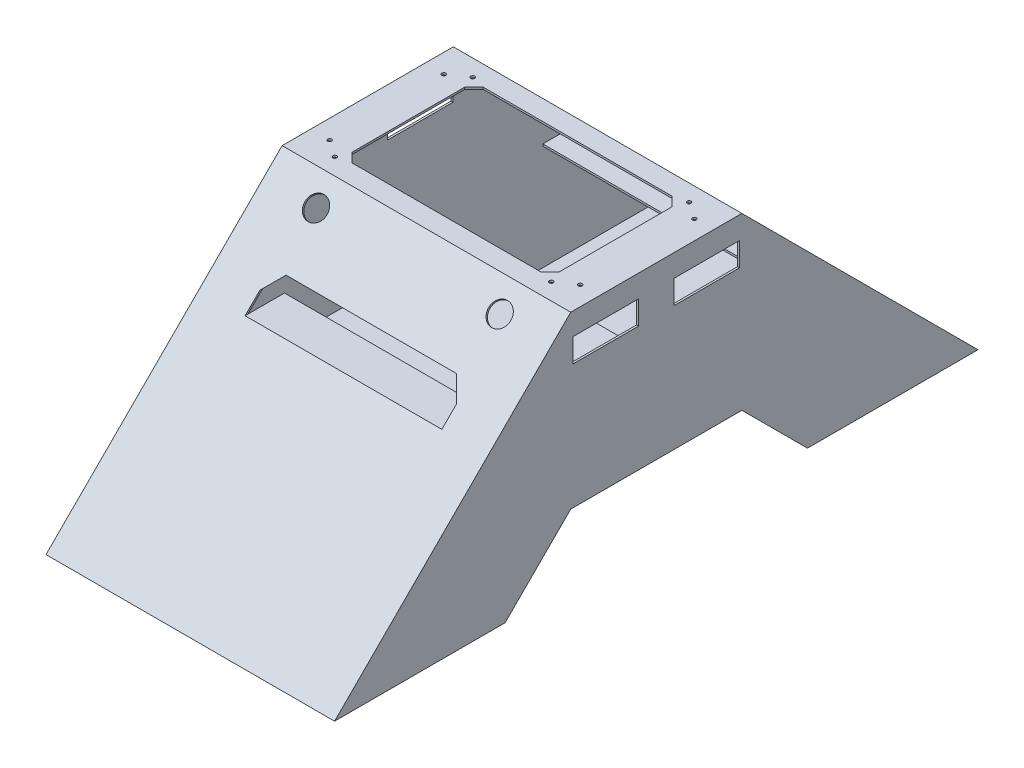
from build123d import *

# Parameters (mm, degrees)
SKETCH1_W                = 220
SKETCH1_H                = 130.5
BOSS_EXTRUDE1_DEPTH      = 3
SKETCH5_W                = 220
SKETCH5_H                = 130.5
BOSS_EXTRUDE2_DEPTH      = 127
SKETCH6_W                = 220
SKETCH6_H                = 130.5
BOSS_EXTRUDE3_DEPTH      = 1
BOSS_EXTRUDE4_DEPTH      = 110
BOSS_EXTRUDE4_DEPTH_BACK = 110
SHELL2_START             = -108.5
SHELL2_DEPTH             = 217
SKETCH2_R                = 1.5
CUT_EXTRUDE1_DEPTH       = 3
CUT_EXTRUDE2_DEPTH       = 10
CUT_EXTRUDE3_DEPTH       = 322.833128344
CUT_EXTRUDE3_DEPTH_BACK  = 322.833128344
SKETCH7_W                = 50
SKETCH7_H                = 18
SKETCH9_R                = 8.5
CUT_EXTRUDE4_DEPTH       = 10
CUT_EXTRUDE5_DEPTH       = 322.833128344
CUT_EXTRUDE5_DEPTH_BACK  = 322.833128344
SKETCH11_W               = 150
SKETCH11_H               = 30
BOSS_EXTRUDE5_DEPTH      = 1.5
SKETCH12_R               = 8.5
CUT_EXTRUDE6_DEPTH       = 1.5


# Read off the part's stored shape, not the designer's step: Shell2
with BuildPart() as part:
    # Sketch1 → Boss-Extrude1 (new body)
    with BuildSketch(Plane(origin=(0, 0, 0), x_dir=(1, 0, 0), z_dir=(0, 1, 0))):
        Rectangle(SKETCH1_W, SKETCH1_H)
    extrude(amount=BOSS_EXTRUDE1_DEPTH)

    # Sketch5 → Boss-Extrude2 (add)
    with BuildSketch(Plane(origin=(0, 0, 0), x_dir=(1, 0, 0), z_dir=(0, 1, 0))):
        Rectangle(SKETCH5_W, SKETCH5_H)
    extrude(amount=-BOSS_EXTRUDE2_DEPTH)

    # Sketch6 → Boss-Extrude3 (add)
    with BuildSketch(Plane.XZ.offset(127)):
        Rectangle(SKETCH6_W, SKETCH6_H)
    extrude(amount=-BOSS_EXTRUDE3_DEPTH)

    # Sketch8 → Boss-Extrude4 (add, two sides: drawn at the far end of the back side and taken through both)
    with BuildSketch(Plane(origin=(0, 0, 0), x_dir=(0, 0, -1), z_dir=(1, 0, 0)).offset(-BOSS_EXTRUDE4_DEPTH_BACK)):
        Polygon((-65.25, 3), (-65.25, -127), (-115.25, -177), (-245.25, -177), align=None)
        Polygon((245.25, -177), (65.25, 3), (65.25, -127), (115.25, -177), align=None)
    extrude(amount=BOSS_EXTRUDE4_DEPTH + BOSS_EXTRUDE4_DEPTH_BACK)

    # Shell2 outline → Shell2 (cut)
    with BuildSketch(Plane.YZ.offset(SHELL2_START)):
        Polygon((-175.5, -241.628679656), (1.5, -64.628679656), (1.5, 64.628679656), (-175.5, 241.628679656), (-175.5, 115.871320344), (-125.5, 65.871320344), (-125.5, -65.871320344), (-175.5, -115.871320344), align=None)
    extrude(amount=SHELL2_DEPTH, mode=Mode.SUBTRACT)

    # Sketch2 → Cut-Extrude1 (cut)
    with BuildSketch(Plane(origin=(0, 0, 0), x_dir=(1, 0, 0), z_dir=(0, 1, 0))):
        with Locations(Location((-82.5, 52.5, 0), (0, 0, 270))):
            Circle(SKETCH2_R)
        with Locations(Location((-82.5, -52.5, 0), (0, 0, 90))):
            Circle(SKETCH2_R)
        with Locations(Location((82.5, -52.5, 0), (0, 0, 270))):
            Circle(SKETCH2_R)
        with Locations(Location((82.5, 52.5, 0), (0, 0, 90))):
            Circle(SKETCH2_R)
        with Locations(Location((-95.5, 43.5, 0), (0, 0, 270))):
            Circle(SKETCH2_R)
        with Locations(Location((-95.5, -43.5, 0), (0, 0, 90))):
            Circle(SKETCH2_R)
        with Locations(Location((95.5, -43.5, 0), (0, 0, 270))):
            Circle(SKETCH2_R)
        with Locations(Location((95.5, 43.5, 0), (0, 0, 90))):
            Circle(SKETCH2_R)
    extrude(amount=CUT_EXTRUDE1_DEPTH, mode=Mode.SUBTRACT)

    # Sketch4 → Cut-Extrude2 (cut)
    with BuildSketch(Plane(origin=(0, 0, 0), x_dir=(1, 0, 0), z_dir=(0, 1, 0))):
        Polygon((-79, 42.928932188), (-71.928932188, 50), (71.928932188, 50), (79, 42.928932188), (79, -42.928932188), (71.928932188, -50), (-71.928932188, -50), (-79, -42.928932188), align=None)
    extrude(amount=CUT_EXTRUDE2_DEPTH, mode=Mode.SUBTRACT)

    # Sketch7 → Cut-Extrude3 (cut, two sides: drawn at the far end of the back side and taken through both)
    with BuildSketch(Plane(origin=(0, 0, 0), x_dir=(0, 0, -1), z_dir=(1, 0, 0)).offset(-CUT_EXTRUDE3_DEPTH_BACK)):
        with Locations((-38.5, -23)):
            Rectangle(SKETCH7_W, SKETCH7_H)
        with Locations((38.5, -23)):
            Rectangle(SKETCH7_W, SKETCH7_H)
    extrude(amount=CUT_EXTRUDE3_DEPTH + CUT_EXTRUDE3_DEPTH_BACK, mode=Mode.SUBTRACT)

    # Sketch9 → Cut-Extrude4 (cut)
    with BuildSketch(Plane(origin=(0, 34.125, 34.125), x_dir=(1, 0, 0), z_dir=(0, 0.7071067811865435, 0.7071067811865517))):
        with Locations(Location((70, -64.017397129, 0), (0, 0, 270))):
            Circle(SKETCH9_R)
        with Locations(Location((-70, -64.017397129, 0), (0, 0, 270))):
            Circle(SKETCH9_R)
    extrude(amount=-CUT_EXTRUDE4_DEPTH, mode=Mode.SUBTRACT)

    # Sketch10 → Cut-Extrude5 (cut, two sides: drawn at the far end of the back side and taken through both)
    with BuildSketch(Plane.XY.offset(-CUT_EXTRUDE5_DEPTH_BACK)):
        Polygon((-75, -49), (-65, -39), (65, -39), (75, -49), (75, -60.2132), (-75, -60.2132), align=None)
    extrude(amount=CUT_EXTRUDE5_DEPTH + CUT_EXTRUDE5_DEPTH_BACK, mode=Mode.SUBTRACT)

    # Sketch11 → Boss-Extrude5 (add)
    with BuildSketch(Plane(origin=(0, -60.2132, 0), x_dir=(1, 0, 0), z_dir=(0, 1, 0))):
        with Locations((0, -113.4632)):
            Rectangle(SKETCH11_W, SKETCH11_H)
        with Locations((0, 113.4632)):
            Rectangle(SKETCH11_W, SKETCH11_H)
    extrude(amount=-BOSS_EXTRUDE5_DEPTH)

    # Sketch12 → Cut-Extrude6 (cut)
    with BuildSketch(Plane(origin=(0, 19.989962184, -48.260037816), x_dir=(1, 0, 0), z_dir=(0, -0.7071067811865438, 0.7071067811865513))):
        with Locations(Location((70, -44.027434945, 0), (0, 0, 270))):
            Circle(SKETCH12_R)
        with Locations(Location((-70, -44.027434945, 0), (0, 0, 90))):
            Circle(SKETCH12_R)
    extrude(amount=CUT_EXTRUDE6_DEPTH, mode=Mode.SUBTRACT)


solid = part.part
